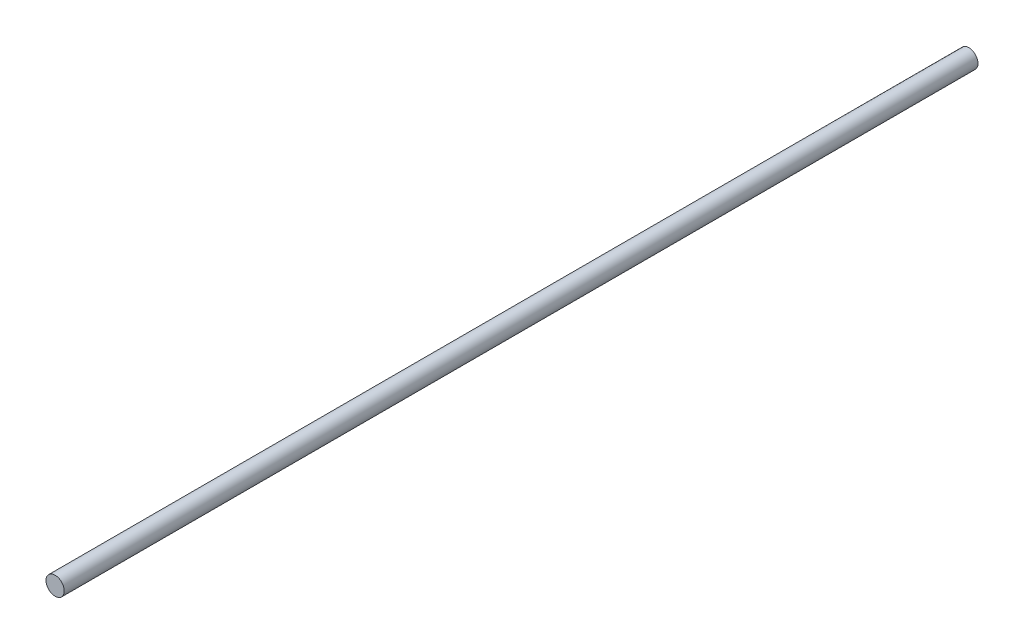
from build123d import *

# Parameters (mm, degrees)
SKETCH_1_R      = 2.5
EXTRUDE_1_DEPTH = 250


with BuildPart() as part:
    # 스케치1 → 보스-돌출1 (new body)
    with BuildSketch(Plane.XY):
        Circle(SKETCH_1_R)
    extrude(amount=EXTRUDE_1_DEPTH)


solid = part.part
